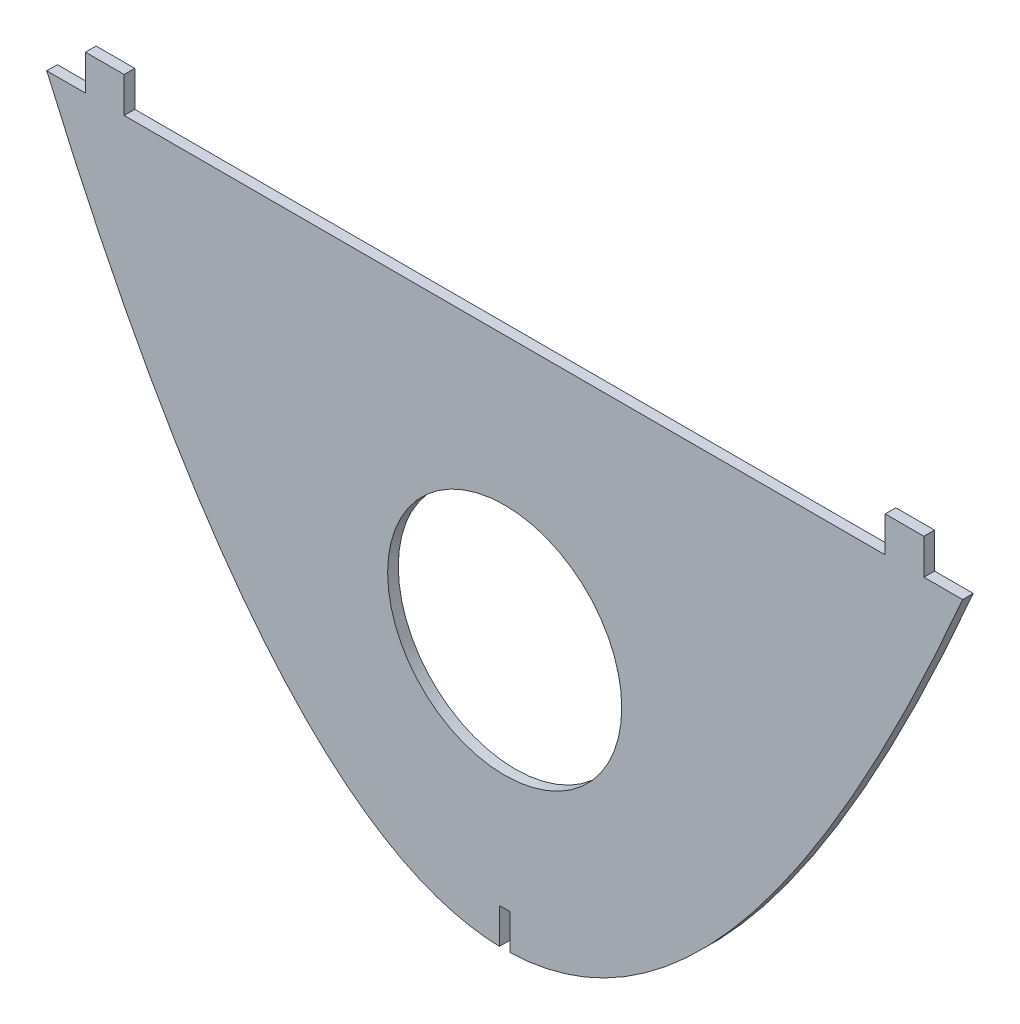
from build123d import *

# Parameters (mm, degrees)
BOSS_EXTRUDE1_DEPTH = 3
SKETCH4_W           = 2.999863356
SKETCH4_H           = 9.998922379
CUT_EXTRUDE1_DEPTH  = 59
SKETCH5_R           = 33
CUT_EXTRUDE2_DEPTH  = 206.610473293


with BuildPart() as part:
    # Sketch1 → Boss-Extrude1 (new body)
    with BuildSketch(Plane.XY):
        with BuildLine():
            Line((-129.099444876, 150.000000006), (-118.189248578, 150.000000006))
            Line((-118.189248578, 150.000000006), (-118.189248578, 160.000000006))
            Line((-118.189248578, 160.000000006), (-107.279052278, 160.000000006))
            Line((-107.279052278, 160.000000006), (-107.279052278, 150.000000004))
            Line((-107.279052278, 150.000000004), (107.279052278, 150.000000004))
            Line((107.279052278, 150.000000004), (107.279052278, 160.000000004))
            Line((107.279052278, 160.000000004), (118.189248572, 160.000000004))
            Line((118.189248572, 160.000000004), (118.189248572, 149.999999993))
            Line((118.189248572, 149.999999993), (129.09944487, 149.999999993))
            add(Edge.make_bspline(
                [(-129.099444876, 150.000000006), (-3e-09, -149.999999999), (129.09944487, 149.999999993)],
                knots=[0.05395051, 0.05395051, 0.05395051, 0.94604949, 0.94604949, 0.94604949], degree=2))
        make_face()
    extrude(amount=BOSS_EXTRUDE1_DEPTH)

    # Sketch4 → Cut-Extrude1 (cut)
    with BuildSketch(Plane.XY):
        with Locations((6.8322e-05, 4.99946119)):
            Rectangle(SKETCH4_W, SKETCH4_H)
    extrude(amount=CUT_EXTRUDE1_DEPTH, mode=Mode.SUBTRACT)

    # Sketch5 → Cut-Extrude2 (cut, through all)
    with BuildSketch(Plane.XY):
        with Locations((0, 75.535470004)):
            Circle(SKETCH5_R)
    extrude(amount=CUT_EXTRUDE2_DEPTH, mode=Mode.SUBTRACT)


solid = part.part
